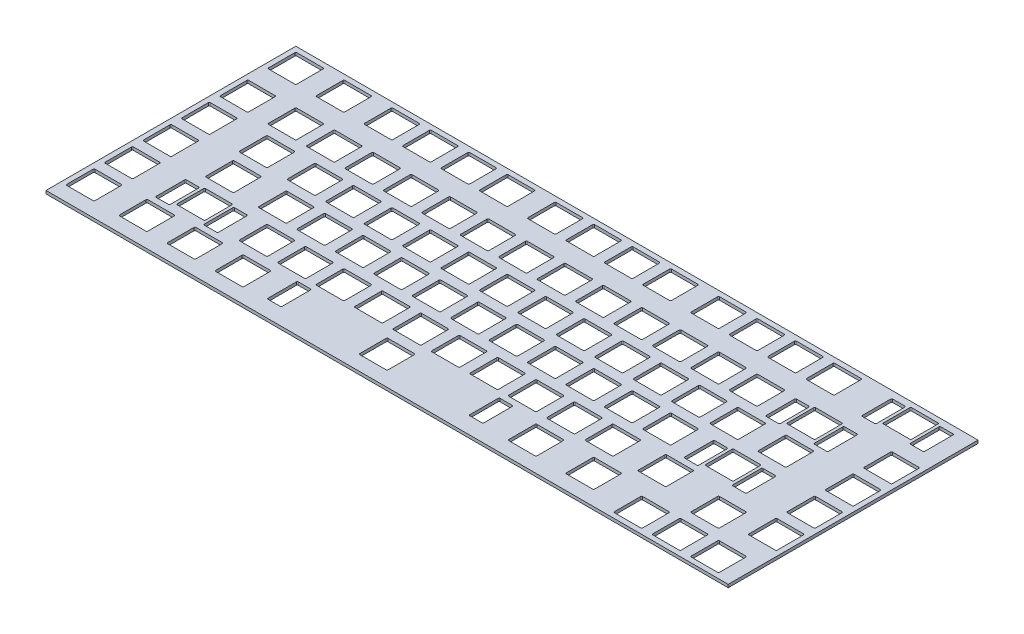
from build123d import *

# Parameters (mm, degrees)
SKETCH1_W           = 338.1375
SKETCH1_H           = 123.825
BOSS_EXTRUDE1_DEPTH = 1.5


with BuildPart() as part:
    # Sketch1 → Boss-Extrude1 (new body)
    with BuildSketch(Plane(origin=(0, 0, 0), x_dir=(1, 0, 0), z_dir=(0, 1, 0))):
        with Locations((169.06875, -61.9125)):
            Rectangle(SKETCH1_W, SKETCH1_H)
        with BuildLine():
            Line((3.025, -2.525), (16.025, -2.525))
            ThreePointArc((16.025, -2.525), (16.378553391, -2.671446609), (16.525, -3.025))
            Line((16.525, -3.025), (16.525, -16.025))
            ThreePointArc((16.525, -16.025), (16.378553391, -16.378553391), (16.025, -16.525))
            Line((16.025, -16.525), (3.025, -16.525))
            ThreePointArc((3.025, -16.525), (2.671446609, -16.378553391), (2.525, -16.025))
            Line((2.525, -16.025), (2.525, -3.025))
            ThreePointArc((2.525, -3.025), (2.671446609, -2.671446609), (3.025, -2.525))
        make_face(mode=Mode.SUBTRACT)
        with BuildLine():
            Line((26.8375, -2.525), (39.8375, -2.525))
            ThreePointArc((39.8375, -2.525), (40.191053391, -2.671446609), (40.3375, -3.025))
            Line((40.3375, -3.025), (40.3375, -16.025))
            ThreePointArc((40.3375, -16.025), (40.191053391, -16.378553391), (39.8375, -16.525))
            Line((39.8375, -16.525), (26.8375, -16.525))
            ThreePointArc((26.8375, -16.525), (26.483946609, -16.378553391), (26.3375, -16.025))
            Line((26.3375, -16.025), (26.3375, -3.025))
            ThreePointArc((26.3375, -3.025), (26.483946609, -2.671446609), (26.8375, -2.525))
        make_face(mode=Mode.SUBTRACT)
        with BuildLine():
            Line((50.65, -2.525), (63.65, -2.525))
            ThreePointArc((63.65, -2.525), (64.003553391, -2.671446609), (64.15, -3.025))
            Line((64.15, -3.025), (64.15, -16.025))
            ThreePointArc((64.15, -16.025), (64.003553391, -16.378553391), (63.65, -16.525))
            Line((63.65, -16.525), (50.65, -16.525))
            ThreePointArc((50.65, -16.525), (50.296446609, -16.378553391), (50.15, -16.025))
            Line((50.15, -16.025), (50.15, -3.025))
            ThreePointArc((50.15, -3.025), (50.296446609, -2.671446609), (50.65, -2.525))
        make_face(mode=Mode.SUBTRACT)
        with BuildLine():
            Line((69.7, -2.525), (82.7, -2.525))
            ThreePointArc((82.7, -2.525), (83.053553391, -2.671446609), (83.2, -3.025))
            Line((83.2, -3.025), (83.2, -16.025))
            ThreePointArc((83.2, -16.025), (83.053553391, -16.378553391), (82.7, -16.525))
            Line((82.7, -16.525), (69.7, -16.525))
            ThreePointArc((69.7, -16.525), (69.346446609, -16.378553391), (69.2, -16.025))
            Line((69.2, -16.025), (69.2, -3.025))
            ThreePointArc((69.2, -3.025), (69.346446609, -2.671446609), (69.7, -2.525))
        make_face(mode=Mode.SUBTRACT)
        with BuildLine():
            Line((88.75, -2.525), (101.75, -2.525))
            ThreePointArc((101.75, -2.525), (102.103553391, -2.671446609), (102.25, -3.025))
            Line((102.25, -3.025), (102.25, -16.025))
            ThreePointArc((102.25, -16.025), (102.103553391, -16.378553391), (101.75, -16.525))
            Line((101.75, -16.525), (88.75, -16.525))
            ThreePointArc((88.75, -16.525), (88.396446609, -16.378553391), (88.25, -16.025))
            Line((88.25, -16.025), (88.25, -3.025))
            ThreePointArc((88.25, -3.025), (88.396446609, -2.671446609), (88.75, -2.525))
        make_face(mode=Mode.SUBTRACT)
        with BuildLine():
            Line((107.8, -2.525), (120.8, -2.525))
            ThreePointArc((120.8, -2.525), (121.153553391, -2.671446609), (121.3, -3.025))
            Line((121.3, -3.025), (121.3, -16.025))
            ThreePointArc((121.3, -16.025), (121.153553391, -16.378553391), (120.8, -16.525))
            Line((120.8, -16.525), (107.8, -16.525))
            ThreePointArc((107.8, -16.525), (107.446446609, -16.378553391), (107.3, -16.025))
            Line((107.3, -16.025), (107.3, -3.025))
            ThreePointArc((107.3, -3.025), (107.446446609, -2.671446609), (107.8, -2.525))
        make_face(mode=Mode.SUBTRACT)
        with BuildLine():
            Line((131.6125, -2.525), (144.6125, -2.525))
            ThreePointArc((144.6125, -2.525), (144.966053391, -2.671446609), (145.1125, -3.025))
            Line((145.1125, -3.025), (145.1125, -16.025))
            ThreePointArc((145.1125, -16.025), (144.966053391, -16.378553391), (144.6125, -16.525))
            Line((144.6125, -16.525), (131.6125, -16.525))
            ThreePointArc((131.6125, -16.525), (131.258946609, -16.378553391), (131.1125, -16.025))
            Line((131.1125, -16.025), (131.1125, -3.025))
            ThreePointArc((131.1125, -3.025), (131.258946609, -2.671446609), (131.6125, -2.525))
        make_face(mode=Mode.SUBTRACT)
        with BuildLine():
            Line((150.6625, -2.525), (163.6625, -2.525))
            ThreePointArc((163.6625, -2.525), (164.016053391, -2.671446609), (164.1625, -3.025))
            Line((164.1625, -3.025), (164.1625, -16.025))
            ThreePointArc((164.1625, -16.025), (164.016053391, -16.378553391), (163.6625, -16.525))
            Line((163.6625, -16.525), (150.6625, -16.525))
            ThreePointArc((150.6625, -16.525), (150.308946609, -16.378553391), (150.1625, -16.025))
            Line((150.1625, -16.025), (150.1625, -3.025))
            ThreePointArc((150.1625, -3.025), (150.308946609, -2.671446609), (150.6625, -2.525))
        make_face(mode=Mode.SUBTRACT)
        with BuildLine():
            Line((169.7125, -2.525), (182.7125, -2.525))
            ThreePointArc((182.7125, -2.525), (183.066053391, -2.671446609), (183.2125, -3.025))
            Line((183.2125, -3.025), (183.2125, -16.025))
            ThreePointArc((183.2125, -16.025), (183.066053391, -16.378553391), (182.7125, -16.525))
            Line((182.7125, -16.525), (169.7125, -16.525))
            ThreePointArc((169.7125, -16.525), (169.358946609, -16.378553391), (169.2125, -16.025))
            Line((169.2125, -16.025), (169.2125, -3.025))
            ThreePointArc((169.2125, -3.025), (169.358946609, -2.671446609), (169.7125, -2.525))
        make_face(mode=Mode.SUBTRACT)
        with BuildLine():
            Line((188.7625, -2.525), (201.7625, -2.525))
            ThreePointArc((201.7625, -2.525), (202.116053391, -2.671446609), (202.2625, -3.025))
            Line((202.2625, -3.025), (202.2625, -16.025))
            ThreePointArc((202.2625, -16.025), (202.116053391, -16.378553391), (201.7625, -16.525))
            Line((201.7625, -16.525), (188.7625, -16.525))
            ThreePointArc((188.7625, -16.525), (188.408946609, -16.378553391), (188.2625, -16.025))
            Line((188.2625, -16.025), (188.2625, -3.025))
            ThreePointArc((188.2625, -3.025), (188.408946609, -2.671446609), (188.7625, -2.525))
        make_face(mode=Mode.SUBTRACT)
        with BuildLine():
            Line((212.575, -2.525), (225.575, -2.525))
            ThreePointArc((225.575, -2.525), (225.928553391, -2.671446609), (226.075, -3.025))
            Line((226.075, -3.025), (226.075, -16.025))
            ThreePointArc((226.075, -16.025), (225.928553391, -16.378553391), (225.575, -16.525))
            Line((225.575, -16.525), (212.575, -16.525))
            ThreePointArc((212.575, -16.525), (212.221446609, -16.378553391), (212.075, -16.025))
            Line((212.075, -16.025), (212.075, -3.025))
            ThreePointArc((212.075, -3.025), (212.221446609, -2.671446609), (212.575, -2.525))
        make_face(mode=Mode.SUBTRACT)
        with BuildLine():
            Line((231.625, -2.525), (244.625, -2.525))
            ThreePointArc((244.625, -2.525), (244.978553391, -2.671446609), (245.125, -3.025))
            Line((245.125, -3.025), (245.125, -16.025))
            ThreePointArc((245.125, -16.025), (244.978553391, -16.378553391), (244.625, -16.525))
            Line((244.625, -16.525), (231.625, -16.525))
            ThreePointArc((231.625, -16.525), (231.271446609, -16.378553391), (231.125, -16.025))
            Line((231.125, -16.025), (231.125, -3.025))
            ThreePointArc((231.125, -3.025), (231.271446609, -2.671446609), (231.625, -2.525))
        make_face(mode=Mode.SUBTRACT)
        with BuildLine():
            Line((250.675, -2.525), (263.675, -2.525))
            ThreePointArc((263.675, -2.525), (264.028553391, -2.671446609), (264.175, -3.025))
            Line((264.175, -3.025), (264.175, -16.025))
            ThreePointArc((264.175, -16.025), (264.028553391, -16.378553391), (263.675, -16.525))
            Line((263.675, -16.525), (250.675, -16.525))
            ThreePointArc((250.675, -16.525), (250.321446609, -16.378553391), (250.175, -16.025))
            Line((250.175, -16.025), (250.175, -3.025))
            ThreePointArc((250.175, -3.025), (250.321446609, -2.671446609), (250.675, -2.525))
        make_face(mode=Mode.SUBTRACT)
        with BuildLine():
            Line((269.725, -2.525), (282.725, -2.525))
            ThreePointArc((282.725, -2.525), (283.078553391, -2.671446609), (283.225, -3.025))
            Line((283.225, -3.025), (283.225, -16.025))
            ThreePointArc((283.225, -16.025), (283.078553391, -16.378553391), (282.725, -16.525))
            Line((282.725, -16.525), (269.725, -16.525))
            ThreePointArc((269.725, -16.525), (269.371446609, -16.378553391), (269.225, -16.025))
            Line((269.225, -16.025), (269.225, -3.025))
            ThreePointArc((269.225, -3.025), (269.371446609, -2.671446609), (269.725, -2.525))
        make_face(mode=Mode.SUBTRACT)
        with BuildLine():
            Line((307.825, -2.525), (320.825, -2.525))
            ThreePointArc((320.825, -2.525), (321.178553391, -2.671446609), (321.325, -3.025))
            Line((321.325, -3.025), (321.325, -16.025))
            ThreePointArc((321.325, -16.025), (321.178553391, -16.378553391), (320.825, -16.525))
            Line((320.825, -16.525), (307.825, -16.525))
            ThreePointArc((307.825, -16.525), (307.471446609, -16.378553391), (307.325, -16.025))
            Line((307.325, -16.025), (307.325, -3.025))
            ThreePointArc((307.325, -3.025), (307.471446609, -2.671446609), (307.825, -2.525))
        make_face(mode=Mode.SUBTRACT)
        with BuildLine():
            Line((299.387, -3.525), (305.387, -3.525))
            ThreePointArc((305.387, -3.525), (305.740553391, -3.671446609), (305.887, -4.025))
            Line((305.887, -4.025), (305.887, -18.025))
            ThreePointArc((305.887, -18.025), (305.740553391, -18.378553391), (305.387, -18.525))
            Line((305.387, -18.525), (299.387, -18.525))
            ThreePointArc((299.387, -18.525), (299.033446609, -18.378553391), (298.887, -18.025))
            Line((298.887, -18.025), (298.887, -4.025))
            ThreePointArc((298.887, -4.025), (299.033446609, -3.671446609), (299.387, -3.525))
        make_face(mode=Mode.SUBTRACT)
        with BuildLine():
            Line((323.263, -3.525), (329.263, -3.525))
            ThreePointArc((329.263, -3.525), (329.616553391, -3.671446609), (329.763, -4.025))
            Line((329.763, -4.025), (329.763, -18.025))
            ThreePointArc((329.763, -18.025), (329.616553391, -18.378553391), (329.263, -18.525))
            Line((329.263, -18.525), (323.263, -18.525))
            ThreePointArc((323.263, -18.525), (322.909446609, -18.378553391), (322.763, -18.025))
            Line((322.763, -18.025), (322.763, -4.025))
            ThreePointArc((322.763, -4.025), (322.909446609, -3.671446609), (323.263, -3.525))
        make_face(mode=Mode.SUBTRACT)
        with BuildLine():
            Line((3.025, -26.3375), (16.025, -26.3375))
            ThreePointArc((16.025, -26.3375), (16.378553391, -26.483946609), (16.525, -26.8375))
            Line((16.525, -26.8375), (16.525, -39.8375))
            ThreePointArc((16.525, -39.8375), (16.378553391, -40.191053391), (16.025, -40.3375))
            Line((16.025, -40.3375), (3.025, -40.3375))
            ThreePointArc((3.025, -40.3375), (2.671446609, -40.191053391), (2.525, -39.8375))
            Line((2.525, -39.8375), (2.525, -26.8375))
            ThreePointArc((2.525, -26.8375), (2.671446609, -26.483946609), (3.025, -26.3375))
        make_face(mode=Mode.SUBTRACT)
        with BuildLine():
            Line((26.8375, -26.3375), (39.8375, -26.3375))
            ThreePointArc((39.8375, -26.3375), (40.191053391, -26.483946609), (40.3375, -26.8375))
            Line((40.3375, -26.8375), (40.3375, -39.8375))
            ThreePointArc((40.3375, -39.8375), (40.191053391, -40.191053391), (39.8375, -40.3375))
            Line((39.8375, -40.3375), (26.8375, -40.3375))
            ThreePointArc((26.8375, -40.3375), (26.483946609, -40.191053391), (26.3375, -39.8375))
            Line((26.3375, -39.8375), (26.3375, -26.8375))
            ThreePointArc((26.3375, -26.8375), (26.483946609, -26.483946609), (26.8375, -26.3375))
        make_face(mode=Mode.SUBTRACT)
        with BuildLine():
            Line((45.8875, -26.3375), (58.8875, -26.3375))
            ThreePointArc((58.8875, -26.3375), (59.241053391, -26.483946609), (59.3875, -26.8375))
            Line((59.3875, -26.8375), (59.3875, -39.8375))
            ThreePointArc((59.3875, -39.8375), (59.241053391, -40.191053391), (58.8875, -40.3375))
            Line((58.8875, -40.3375), (45.8875, -40.3375))
            ThreePointArc((45.8875, -40.3375), (45.533946609, -40.191053391), (45.3875, -39.8375))
            Line((45.3875, -39.8375), (45.3875, -26.8375))
            ThreePointArc((45.3875, -26.8375), (45.533946609, -26.483946609), (45.8875, -26.3375))
        make_face(mode=Mode.SUBTRACT)
        with BuildLine():
            Line((64.9375, -26.3375), (77.9375, -26.3375))
            ThreePointArc((77.9375, -26.3375), (78.291053391, -26.483946609), (78.4375, -26.8375))
            Line((78.4375, -26.8375), (78.4375, -39.8375))
            ThreePointArc((78.4375, -39.8375), (78.291053391, -40.191053391), (77.9375, -40.3375))
            Line((77.9375, -40.3375), (64.9375, -40.3375))
            ThreePointArc((64.9375, -40.3375), (64.583946609, -40.191053391), (64.4375, -39.8375))
            Line((64.4375, -39.8375), (64.4375, -26.8375))
            ThreePointArc((64.4375, -26.8375), (64.583946609, -26.483946609), (64.9375, -26.3375))
        make_face(mode=Mode.SUBTRACT)
        with BuildLine():
            Line((83.9875, -26.3375), (96.9875, -26.3375))
            ThreePointArc((96.9875, -26.3375), (97.341053391, -26.483946609), (97.4875, -26.8375))
            Line((97.4875, -26.8375), (97.4875, -39.8375))
            ThreePointArc((97.4875, -39.8375), (97.341053391, -40.191053391), (96.9875, -40.3375))
            Line((96.9875, -40.3375), (83.9875, -40.3375))
            ThreePointArc((83.9875, -40.3375), (83.633946609, -40.191053391), (83.4875, -39.8375))
            Line((83.4875, -39.8375), (83.4875, -26.8375))
            ThreePointArc((83.4875, -26.8375), (83.633946609, -26.483946609), (83.9875, -26.3375))
        make_face(mode=Mode.SUBTRACT)
        with BuildLine():
            Line((103.0375, -26.3375), (116.0375, -26.3375))
            ThreePointArc((116.0375, -26.3375), (116.391053391, -26.483946609), (116.5375, -26.8375))
            Line((116.5375, -26.8375), (116.5375, -39.8375))
            ThreePointArc((116.5375, -39.8375), (116.391053391, -40.191053391), (116.0375, -40.3375))
            Line((116.0375, -40.3375), (103.0375, -40.3375))
            ThreePointArc((103.0375, -40.3375), (102.683946609, -40.191053391), (102.5375, -39.8375))
            Line((102.5375, -39.8375), (102.5375, -26.8375))
            ThreePointArc((102.5375, -26.8375), (102.683946609, -26.483946609), (103.0375, -26.3375))
        make_face(mode=Mode.SUBTRACT)
        with BuildLine():
            Line((122.0875, -26.3375), (135.0875, -26.3375))
            ThreePointArc((135.0875, -26.3375), (135.441053391, -26.483946609), (135.5875, -26.8375))
            Line((135.5875, -26.8375), (135.5875, -39.8375))
            ThreePointArc((135.5875, -39.8375), (135.441053391, -40.191053391), (135.0875, -40.3375))
            Line((135.0875, -40.3375), (122.0875, -40.3375))
            ThreePointArc((122.0875, -40.3375), (121.733946609, -40.191053391), (121.5875, -39.8375))
            Line((121.5875, -39.8375), (121.5875, -26.8375))
            ThreePointArc((121.5875, -26.8375), (121.733946609, -26.483946609), (122.0875, -26.3375))
        make_face(mode=Mode.SUBTRACT)
        with BuildLine():
            Line((141.1375, -26.3375), (154.1375, -26.3375))
            ThreePointArc((154.1375, -26.3375), (154.491053391, -26.483946609), (154.6375, -26.8375))
            Line((154.6375, -26.8375), (154.6375, -39.8375))
            ThreePointArc((154.6375, -39.8375), (154.491053391, -40.191053391), (154.1375, -40.3375))
            Line((154.1375, -40.3375), (141.1375, -40.3375))
            ThreePointArc((141.1375, -40.3375), (140.783946609, -40.191053391), (140.6375, -39.8375))
            Line((140.6375, -39.8375), (140.6375, -26.8375))
            ThreePointArc((140.6375, -26.8375), (140.783946609, -26.483946609), (141.1375, -26.3375))
        make_face(mode=Mode.SUBTRACT)
        with BuildLine():
            Line((160.1875, -26.3375), (173.1875, -26.3375))
            ThreePointArc((173.1875, -26.3375), (173.541053391, -26.483946609), (173.6875, -26.8375))
            Line((173.6875, -26.8375), (173.6875, -39.8375))
            ThreePointArc((173.6875, -39.8375), (173.541053391, -40.191053391), (173.1875, -40.3375))
            Line((173.1875, -40.3375), (160.1875, -40.3375))
            ThreePointArc((160.1875, -40.3375), (159.833946609, -40.191053391), (159.6875, -39.8375))
            Line((159.6875, -39.8375), (159.6875, -26.8375))
            ThreePointArc((159.6875, -26.8375), (159.833946609, -26.483946609), (160.1875, -26.3375))
        make_face(mode=Mode.SUBTRACT)
        with BuildLine():
            Line((179.2375, -26.3375), (192.2375, -26.3375))
            ThreePointArc((192.2375, -26.3375), (192.591053391, -26.483946609), (192.7375, -26.8375))
            Line((192.7375, -26.8375), (192.7375, -39.8375))
            ThreePointArc((192.7375, -39.8375), (192.591053391, -40.191053391), (192.2375, -40.3375))
            Line((192.2375, -40.3375), (179.2375, -40.3375))
            ThreePointArc((179.2375, -40.3375), (178.883946609, -40.191053391), (178.7375, -39.8375))
            Line((178.7375, -39.8375), (178.7375, -26.8375))
            ThreePointArc((178.7375, -26.8375), (178.883946609, -26.483946609), (179.2375, -26.3375))
        make_face(mode=Mode.SUBTRACT)
        with BuildLine():
            Line((198.2875, -26.3375), (211.2875, -26.3375))
            ThreePointArc((211.2875, -26.3375), (211.641053391, -26.483946609), (211.7875, -26.8375))
            Line((211.7875, -26.8375), (211.7875, -39.8375))
            ThreePointArc((211.7875, -39.8375), (211.641053391, -40.191053391), (211.2875, -40.3375))
            Line((211.2875, -40.3375), (198.2875, -40.3375))
            ThreePointArc((198.2875, -40.3375), (197.933946609, -40.191053391), (197.7875, -39.8375))
            Line((197.7875, -39.8375), (197.7875, -26.8375))
            ThreePointArc((197.7875, -26.8375), (197.933946609, -26.483946609), (198.2875, -26.3375))
        make_face(mode=Mode.SUBTRACT)
        with BuildLine():
            Line((217.3375, -26.3375), (230.3375, -26.3375))
            ThreePointArc((230.3375, -26.3375), (230.691053391, -26.483946609), (230.8375, -26.8375))
            Line((230.8375, -26.8375), (230.8375, -39.8375))
            ThreePointArc((230.8375, -39.8375), (230.691053391, -40.191053391), (230.3375, -40.3375))
            Line((230.3375, -40.3375), (217.3375, -40.3375))
            ThreePointArc((217.3375, -40.3375), (216.983946609, -40.191053391), (216.8375, -39.8375))
            Line((216.8375, -39.8375), (216.8375, -26.8375))
            ThreePointArc((216.8375, -26.8375), (216.983946609, -26.483946609), (217.3375, -26.3375))
        make_face(mode=Mode.SUBTRACT)
        with BuildLine():
            Line((236.3875, -26.3375), (249.3875, -26.3375))
            ThreePointArc((249.3875, -26.3375), (249.741053391, -26.483946609), (249.8875, -26.8375))
            Line((249.8875, -26.8375), (249.8875, -39.8375))
            ThreePointArc((249.8875, -39.8375), (249.741053391, -40.191053391), (249.3875, -40.3375))
            Line((249.3875, -40.3375), (236.3875, -40.3375))
            ThreePointArc((236.3875, -40.3375), (236.033946609, -40.191053391), (235.8875, -39.8375))
            Line((235.8875, -39.8375), (235.8875, -26.8375))
            ThreePointArc((235.8875, -26.8375), (236.033946609, -26.483946609), (236.3875, -26.3375))
        make_face(mode=Mode.SUBTRACT)
        with BuildLine():
            Line((255.4375, -26.3375), (268.4375, -26.3375))
            ThreePointArc((268.4375, -26.3375), (268.791053391, -26.483946609), (268.9375, -26.8375))
            Line((268.9375, -26.8375), (268.9375, -39.8375))
            ThreePointArc((268.9375, -39.8375), (268.791053391, -40.191053391), (268.4375, -40.3375))
            Line((268.4375, -40.3375), (255.4375, -40.3375))
            ThreePointArc((255.4375, -40.3375), (255.083946609, -40.191053391), (254.9375, -39.8375))
            Line((254.9375, -39.8375), (254.9375, -26.8375))
            ThreePointArc((254.9375, -26.8375), (255.083946609, -26.483946609), (255.4375, -26.3375))
        make_face(mode=Mode.SUBTRACT)
        with BuildLine():
            Line((284.0125, -26.3375), (297.0125, -26.3375))
            ThreePointArc((297.0125, -26.3375), (297.366053391, -26.483946609), (297.5125, -26.8375))
            Line((297.5125, -26.8375), (297.5125, -39.8375))
            ThreePointArc((297.5125, -39.8375), (297.366053391, -40.191053391), (297.0125, -40.3375))
            Line((297.0125, -40.3375), (284.0125, -40.3375))
            ThreePointArc((284.0125, -40.3375), (283.658946609, -40.191053391), (283.5125, -39.8375))
            Line((283.5125, -39.8375), (283.5125, -26.8375))
            ThreePointArc((283.5125, -26.8375), (283.658946609, -26.483946609), (284.0125, -26.3375))
        make_face(mode=Mode.SUBTRACT)
        with BuildLine():
            Line((275.5745, -27.3375), (281.5745, -27.3375))
            ThreePointArc((281.5745, -27.3375), (281.928053391, -27.483946609), (282.0745, -27.8375))
            Line((282.0745, -27.8375), (282.0745, -41.8375))
            ThreePointArc((282.0745, -41.8375), (281.928053391, -42.191053391), (281.5745, -42.3375))
            Line((281.5745, -42.3375), (275.5745, -42.3375))
            ThreePointArc((275.5745, -42.3375), (275.220946609, -42.191053391), (275.0745, -41.8375))
            Line((275.0745, -41.8375), (275.0745, -27.8375))
            ThreePointArc((275.0745, -27.8375), (275.220946609, -27.483946609), (275.5745, -27.3375))
        make_face(mode=Mode.SUBTRACT)
        with BuildLine():
            Line((299.4505, -27.3375), (305.4505, -27.3375))
            ThreePointArc((305.4505, -27.3375), (305.804053391, -27.483946609), (305.9505, -27.8375))
            Line((305.9505, -27.8375), (305.9505, -41.8375))
            ThreePointArc((305.9505, -41.8375), (305.804053391, -42.191053391), (305.4505, -42.3375))
            Line((305.4505, -42.3375), (299.4505, -42.3375))
            ThreePointArc((299.4505, -42.3375), (299.096946609, -42.191053391), (298.9505, -41.8375))
            Line((298.9505, -41.8375), (298.9505, -27.8375))
            ThreePointArc((298.9505, -27.8375), (299.096946609, -27.483946609), (299.4505, -27.3375))
        make_face(mode=Mode.SUBTRACT)
        with BuildLine():
            Line((322.1125, -26.3375), (335.1125, -26.3375))
            ThreePointArc((335.1125, -26.3375), (335.466053391, -26.483946609), (335.6125, -26.8375))
            Line((335.6125, -26.8375), (335.6125, -39.8375))
            ThreePointArc((335.6125, -39.8375), (335.466053391, -40.191053391), (335.1125, -40.3375))
            Line((335.1125, -40.3375), (322.1125, -40.3375))
            ThreePointArc((322.1125, -40.3375), (321.758946609, -40.191053391), (321.6125, -39.8375))
            Line((321.6125, -39.8375), (321.6125, -26.8375))
            ThreePointArc((321.6125, -26.8375), (321.758946609, -26.483946609), (322.1125, -26.3375))
        make_face(mode=Mode.SUBTRACT)
        with BuildLine():
            Line((3.025, -45.3875), (16.025, -45.3875))
            ThreePointArc((16.025, -45.3875), (16.378553391, -45.533946609), (16.525, -45.8875))
            Line((16.525, -45.8875), (16.525, -58.8875))
            ThreePointArc((16.525, -58.8875), (16.378553391, -59.241053391), (16.025, -59.3875))
            Line((16.025, -59.3875), (3.025, -59.3875))
            ThreePointArc((3.025, -59.3875), (2.671446609, -59.241053391), (2.525, -58.8875))
            Line((2.525, -58.8875), (2.525, -45.8875))
            ThreePointArc((2.525, -45.8875), (2.671446609, -45.533946609), (3.025, -45.3875))
        make_face(mode=Mode.SUBTRACT)
        with BuildLine():
            Line((31.6, -45.3875), (44.6, -45.3875))
            ThreePointArc((44.6, -45.3875), (44.953553391, -45.533946609), (45.1, -45.8875))
            Line((45.1, -45.8875), (45.1, -58.8875))
            ThreePointArc((45.1, -58.8875), (44.953553391, -59.241053391), (44.6, -59.3875))
            Line((44.6, -59.3875), (31.6, -59.3875))
            ThreePointArc((31.6, -59.3875), (31.246446609, -59.241053391), (31.1, -58.8875))
            Line((31.1, -58.8875), (31.1, -45.8875))
            ThreePointArc((31.1, -45.8875), (31.246446609, -45.533946609), (31.6, -45.3875))
        make_face(mode=Mode.SUBTRACT)
        with BuildLine():
            Line((55.4125, -45.3875), (68.4125, -45.3875))
            ThreePointArc((68.4125, -45.3875), (68.766053391, -45.533946609), (68.9125, -45.8875))
            Line((68.9125, -45.8875), (68.9125, -58.8875))
            ThreePointArc((68.9125, -58.8875), (68.766053391, -59.241053391), (68.4125, -59.3875))
            Line((68.4125, -59.3875), (55.4125, -59.3875))
            ThreePointArc((55.4125, -59.3875), (55.058946609, -59.241053391), (54.9125, -58.8875))
            Line((54.9125, -58.8875), (54.9125, -45.8875))
            ThreePointArc((54.9125, -45.8875), (55.058946609, -45.533946609), (55.4125, -45.3875))
        make_face(mode=Mode.SUBTRACT)
        with BuildLine():
            Line((74.4625, -45.3875), (87.4625, -45.3875))
            ThreePointArc((87.4625, -45.3875), (87.816053391, -45.533946609), (87.9625, -45.8875))
            Line((87.9625, -45.8875), (87.9625, -58.8875))
            ThreePointArc((87.9625, -58.8875), (87.816053391, -59.241053391), (87.4625, -59.3875))
            Line((87.4625, -59.3875), (74.4625, -59.3875))
            ThreePointArc((74.4625, -59.3875), (74.108946609, -59.241053391), (73.9625, -58.8875))
            Line((73.9625, -58.8875), (73.9625, -45.8875))
            ThreePointArc((73.9625, -45.8875), (74.108946609, -45.533946609), (74.4625, -45.3875))
        make_face(mode=Mode.SUBTRACT)
        with BuildLine():
            Line((93.5125, -45.3875), (106.5125, -45.3875))
            ThreePointArc((106.5125, -45.3875), (106.866053391, -45.533946609), (107.0125, -45.8875))
            Line((107.0125, -45.8875), (107.0125, -58.8875))
            ThreePointArc((107.0125, -58.8875), (106.866053391, -59.241053391), (106.5125, -59.3875))
            Line((106.5125, -59.3875), (93.5125, -59.3875))
            ThreePointArc((93.5125, -59.3875), (93.158946609, -59.241053391), (93.0125, -58.8875))
            Line((93.0125, -58.8875), (93.0125, -45.8875))
            ThreePointArc((93.0125, -45.8875), (93.158946609, -45.533946609), (93.5125, -45.3875))
        make_face(mode=Mode.SUBTRACT)
        with BuildLine():
            Line((112.5625, -45.3875), (125.5625, -45.3875))
            ThreePointArc((125.5625, -45.3875), (125.916053391, -45.533946609), (126.0625, -45.8875))
            Line((126.0625, -45.8875), (126.0625, -58.8875))
            ThreePointArc((126.0625, -58.8875), (125.916053391, -59.241053391), (125.5625, -59.3875))
            Line((125.5625, -59.3875), (112.5625, -59.3875))
            ThreePointArc((112.5625, -59.3875), (112.208946609, -59.241053391), (112.0625, -58.8875))
            Line((112.0625, -58.8875), (112.0625, -45.8875))
            ThreePointArc((112.0625, -45.8875), (112.208946609, -45.533946609), (112.5625, -45.3875))
        make_face(mode=Mode.SUBTRACT)
        with BuildLine():
            Line((131.6125, -45.3875), (144.6125, -45.3875))
            ThreePointArc((144.6125, -45.3875), (144.966053391, -45.533946609), (145.1125, -45.8875))
            Line((145.1125, -45.8875), (145.1125, -58.8875))
            ThreePointArc((145.1125, -58.8875), (144.966053391, -59.241053391), (144.6125, -59.3875))
            Line((144.6125, -59.3875), (131.6125, -59.3875))
            ThreePointArc((131.6125, -59.3875), (131.258946609, -59.241053391), (131.1125, -58.8875))
            Line((131.1125, -58.8875), (131.1125, -45.8875))
            ThreePointArc((131.1125, -45.8875), (131.258946609, -45.533946609), (131.6125, -45.3875))
        make_face(mode=Mode.SUBTRACT)
        with BuildLine():
            Line((150.6625, -45.3875), (163.6625, -45.3875))
            ThreePointArc((163.6625, -45.3875), (164.016053391, -45.533946609), (164.1625, -45.8875))
            Line((164.1625, -45.8875), (164.1625, -58.8875))
            ThreePointArc((164.1625, -58.8875), (164.016053391, -59.241053391), (163.6625, -59.3875))
            Line((163.6625, -59.3875), (150.6625, -59.3875))
            ThreePointArc((150.6625, -59.3875), (150.308946609, -59.241053391), (150.1625, -58.8875))
            Line((150.1625, -58.8875), (150.1625, -45.8875))
            ThreePointArc((150.1625, -45.8875), (150.308946609, -45.533946609), (150.6625, -45.3875))
        make_face(mode=Mode.SUBTRACT)
        with BuildLine():
            Line((169.7125, -45.3875), (182.7125, -45.3875))
            ThreePointArc((182.7125, -45.3875), (183.066053391, -45.533946609), (183.2125, -45.8875))
            Line((183.2125, -45.8875), (183.2125, -58.8875))
            ThreePointArc((183.2125, -58.8875), (183.066053391, -59.241053391), (182.7125, -59.3875))
            Line((182.7125, -59.3875), (169.7125, -59.3875))
            ThreePointArc((169.7125, -59.3875), (169.358946609, -59.241053391), (169.2125, -58.8875))
            Line((169.2125, -58.8875), (169.2125, -45.8875))
            ThreePointArc((169.2125, -45.8875), (169.358946609, -45.533946609), (169.7125, -45.3875))
        make_face(mode=Mode.SUBTRACT)
        with BuildLine():
            Line((188.7625, -45.3875), (201.7625, -45.3875))
            ThreePointArc((201.7625, -45.3875), (202.116053391, -45.533946609), (202.2625, -45.8875))
            Line((202.2625, -45.8875), (202.2625, -58.8875))
            ThreePointArc((202.2625, -58.8875), (202.116053391, -59.241053391), (201.7625, -59.3875))
            Line((201.7625, -59.3875), (188.7625, -59.3875))
            ThreePointArc((188.7625, -59.3875), (188.408946609, -59.241053391), (188.2625, -58.8875))
            Line((188.2625, -58.8875), (188.2625, -45.8875))
            ThreePointArc((188.2625, -45.8875), (188.408946609, -45.533946609), (188.7625, -45.3875))
        make_face(mode=Mode.SUBTRACT)
        with BuildLine():
            Line((207.8125, -45.3875), (220.8125, -45.3875))
            ThreePointArc((220.8125, -45.3875), (221.166053391, -45.533946609), (221.3125, -45.8875))
            Line((221.3125, -45.8875), (221.3125, -58.8875))
            ThreePointArc((221.3125, -58.8875), (221.166053391, -59.241053391), (220.8125, -59.3875))
            Line((220.8125, -59.3875), (207.8125, -59.3875))
            ThreePointArc((207.8125, -59.3875), (207.458946609, -59.241053391), (207.3125, -58.8875))
            Line((207.3125, -58.8875), (207.3125, -45.8875))
            ThreePointArc((207.3125, -45.8875), (207.458946609, -45.533946609), (207.8125, -45.3875))
        make_face(mode=Mode.SUBTRACT)
        with BuildLine():
            Line((226.8625, -45.3875), (239.8625, -45.3875))
            ThreePointArc((239.8625, -45.3875), (240.216053391, -45.533946609), (240.3625, -45.8875))
            Line((240.3625, -45.8875), (240.3625, -58.8875))
            ThreePointArc((240.3625, -58.8875), (240.216053391, -59.241053391), (239.8625, -59.3875))
            Line((239.8625, -59.3875), (226.8625, -59.3875))
            ThreePointArc((226.8625, -59.3875), (226.508946609, -59.241053391), (226.3625, -58.8875))
            Line((226.3625, -58.8875), (226.3625, -45.8875))
            ThreePointArc((226.3625, -45.8875), (226.508946609, -45.533946609), (226.8625, -45.3875))
        make_face(mode=Mode.SUBTRACT)
        with BuildLine():
            Line((245.9125, -45.3875), (258.9125, -45.3875))
            ThreePointArc((258.9125, -45.3875), (259.266053391, -45.533946609), (259.4125, -45.8875))
            Line((259.4125, -45.8875), (259.4125, -58.8875))
            ThreePointArc((259.4125, -58.8875), (259.266053391, -59.241053391), (258.9125, -59.3875))
            Line((258.9125, -59.3875), (245.9125, -59.3875))
            ThreePointArc((245.9125, -59.3875), (245.558946609, -59.241053391), (245.4125, -58.8875))
            Line((245.4125, -58.8875), (245.4125, -45.8875))
            ThreePointArc((245.4125, -45.8875), (245.558946609, -45.533946609), (245.9125, -45.3875))
        make_face(mode=Mode.SUBTRACT)
        with BuildLine():
            Line((264.9625, -45.3875), (277.9625, -45.3875))
            ThreePointArc((277.9625, -45.3875), (278.316053391, -45.533946609), (278.4625, -45.8875))
            Line((278.4625, -45.8875), (278.4625, -58.8875))
            ThreePointArc((278.4625, -58.8875), (278.316053391, -59.241053391), (277.9625, -59.3875))
            Line((277.9625, -59.3875), (264.9625, -59.3875))
            ThreePointArc((264.9625, -59.3875), (264.608946609, -59.241053391), (264.4625, -58.8875))
            Line((264.4625, -58.8875), (264.4625, -45.8875))
            ThreePointArc((264.4625, -45.8875), (264.608946609, -45.533946609), (264.9625, -45.3875))
        make_face(mode=Mode.SUBTRACT)
        with BuildLine():
            Line((288.775, -45.3875), (301.775, -45.3875))
            ThreePointArc((301.775, -45.3875), (302.128553391, -45.533946609), (302.275, -45.8875))
            Line((302.275, -45.8875), (302.275, -58.8875))
            ThreePointArc((302.275, -58.8875), (302.128553391, -59.241053391), (301.775, -59.3875))
            Line((301.775, -59.3875), (288.775, -59.3875))
            ThreePointArc((288.775, -59.3875), (288.421446609, -59.241053391), (288.275, -58.8875))
            Line((288.275, -58.8875), (288.275, -45.8875))
            ThreePointArc((288.275, -45.8875), (288.421446609, -45.533946609), (288.775, -45.3875))
        make_face(mode=Mode.SUBTRACT)
        with BuildLine():
            Line((322.1125, -45.3875), (335.1125, -45.3875))
            ThreePointArc((335.1125, -45.3875), (335.466053391, -45.533946609), (335.6125, -45.8875))
            Line((335.6125, -45.8875), (335.6125, -58.8875))
            ThreePointArc((335.6125, -58.8875), (335.466053391, -59.241053391), (335.1125, -59.3875))
            Line((335.1125, -59.3875), (322.1125, -59.3875))
            ThreePointArc((322.1125, -59.3875), (321.758946609, -59.241053391), (321.6125, -58.8875))
            Line((321.6125, -58.8875), (321.6125, -45.8875))
            ThreePointArc((321.6125, -45.8875), (321.758946609, -45.533946609), (322.1125, -45.3875))
        make_face(mode=Mode.SUBTRACT)
        with BuildLine():
            Line((3.025, -64.4375), (16.025, -64.4375))
            ThreePointArc((16.025, -64.4375), (16.378553391, -64.583946609), (16.525, -64.9375))
            Line((16.525, -64.9375), (16.525, -77.9375))
            ThreePointArc((16.525, -77.9375), (16.378553391, -78.291053391), (16.025, -78.4375))
            Line((16.025, -78.4375), (3.025, -78.4375))
            ThreePointArc((3.025, -78.4375), (2.671446609, -78.291053391), (2.525, -77.9375))
            Line((2.525, -77.9375), (2.525, -64.9375))
            ThreePointArc((2.525, -64.9375), (2.671446609, -64.583946609), (3.025, -64.4375))
        make_face(mode=Mode.SUBTRACT)
        with BuildLine():
            Line((33.98125, -64.4375), (46.98125, -64.4375))
            ThreePointArc((46.98125, -64.4375), (47.334803391, -64.583946609), (47.48125, -64.9375))
            Line((47.48125, -64.9375), (47.48125, -77.9375))
            ThreePointArc((47.48125, -77.9375), (47.334803391, -78.291053391), (46.98125, -78.4375))
            Line((46.98125, -78.4375), (33.98125, -78.4375))
            ThreePointArc((33.98125, -78.4375), (33.627696609, -78.291053391), (33.48125, -77.9375))
            Line((33.48125, -77.9375), (33.48125, -64.9375))
            ThreePointArc((33.48125, -64.9375), (33.627696609, -64.583946609), (33.98125, -64.4375))
        make_face(mode=Mode.SUBTRACT)
        with BuildLine():
            Line((60.175, -64.4375), (73.175, -64.4375))
            ThreePointArc((73.175, -64.4375), (73.528553391, -64.583946609), (73.675, -64.9375))
            Line((73.675, -64.9375), (73.675, -77.9375))
            ThreePointArc((73.675, -77.9375), (73.528553391, -78.291053391), (73.175, -78.4375))
            Line((73.175, -78.4375), (60.175, -78.4375))
            ThreePointArc((60.175, -78.4375), (59.821446609, -78.291053391), (59.675, -77.9375))
            Line((59.675, -77.9375), (59.675, -64.9375))
            ThreePointArc((59.675, -64.9375), (59.821446609, -64.583946609), (60.175, -64.4375))
        make_face(mode=Mode.SUBTRACT)
        with BuildLine():
            Line((79.225, -64.4375), (92.225, -64.4375))
            ThreePointArc((92.225, -64.4375), (92.578553391, -64.583946609), (92.725, -64.9375))
            Line((92.725, -64.9375), (92.725, -77.9375))
            ThreePointArc((92.725, -77.9375), (92.578553391, -78.291053391), (92.225, -78.4375))
            Line((92.225, -78.4375), (79.225, -78.4375))
            ThreePointArc((79.225, -78.4375), (78.871446609, -78.291053391), (78.725, -77.9375))
            Line((78.725, -77.9375), (78.725, -64.9375))
            ThreePointArc((78.725, -64.9375), (78.871446609, -64.583946609), (79.225, -64.4375))
        make_face(mode=Mode.SUBTRACT)
        with BuildLine():
            Line((98.275, -64.4375), (111.275, -64.4375))
            ThreePointArc((111.275, -64.4375), (111.628553391, -64.583946609), (111.775, -64.9375))
            Line((111.775, -64.9375), (111.775, -77.9375))
            ThreePointArc((111.775, -77.9375), (111.628553391, -78.291053391), (111.275, -78.4375))
            Line((111.275, -78.4375), (98.275, -78.4375))
            ThreePointArc((98.275, -78.4375), (97.921446609, -78.291053391), (97.775, -77.9375))
            Line((97.775, -77.9375), (97.775, -64.9375))
            ThreePointArc((97.775, -64.9375), (97.921446609, -64.583946609), (98.275, -64.4375))
        make_face(mode=Mode.SUBTRACT)
        with BuildLine():
            Line((117.325, -64.4375), (130.325, -64.4375))
            ThreePointArc((130.325, -64.4375), (130.678553391, -64.583946609), (130.825, -64.9375))
            Line((130.825, -64.9375), (130.825, -77.9375))
            ThreePointArc((130.825, -77.9375), (130.678553391, -78.291053391), (130.325, -78.4375))
            Line((130.325, -78.4375), (117.325, -78.4375))
            ThreePointArc((117.325, -78.4375), (116.971446609, -78.291053391), (116.825, -77.9375))
            Line((116.825, -77.9375), (116.825, -64.9375))
            ThreePointArc((116.825, -64.9375), (116.971446609, -64.583946609), (117.325, -64.4375))
        make_face(mode=Mode.SUBTRACT)
        with BuildLine():
            Line((136.375, -64.4375), (149.375, -64.4375))
            ThreePointArc((149.375, -64.4375), (149.728553391, -64.583946609), (149.875, -64.9375))
            Line((149.875, -64.9375), (149.875, -77.9375))
            ThreePointArc((149.875, -77.9375), (149.728553391, -78.291053391), (149.375, -78.4375))
            Line((149.375, -78.4375), (136.375, -78.4375))
            ThreePointArc((136.375, -78.4375), (136.021446609, -78.291053391), (135.875, -77.9375))
            Line((135.875, -77.9375), (135.875, -64.9375))
            ThreePointArc((135.875, -64.9375), (136.021446609, -64.583946609), (136.375, -64.4375))
        make_face(mode=Mode.SUBTRACT)
        with BuildLine():
            Line((155.425, -64.4375), (168.425, -64.4375))
            ThreePointArc((168.425, -64.4375), (168.778553391, -64.583946609), (168.925, -64.9375))
            Line((168.925, -64.9375), (168.925, -77.9375))
            ThreePointArc((168.925, -77.9375), (168.778553391, -78.291053391), (168.425, -78.4375))
            Line((168.425, -78.4375), (155.425, -78.4375))
            ThreePointArc((155.425, -78.4375), (155.071446609, -78.291053391), (154.925, -77.9375))
            Line((154.925, -77.9375), (154.925, -64.9375))
            ThreePointArc((154.925, -64.9375), (155.071446609, -64.583946609), (155.425, -64.4375))
        make_face(mode=Mode.SUBTRACT)
        with BuildLine():
            Line((174.475, -64.4375), (187.475, -64.4375))
            ThreePointArc((187.475, -64.4375), (187.828553391, -64.583946609), (187.975, -64.9375))
            Line((187.975, -64.9375), (187.975, -77.9375))
            ThreePointArc((187.975, -77.9375), (187.828553391, -78.291053391), (187.475, -78.4375))
            Line((187.475, -78.4375), (174.475, -78.4375))
            ThreePointArc((174.475, -78.4375), (174.121446609, -78.291053391), (173.975, -77.9375))
            Line((173.975, -77.9375), (173.975, -64.9375))
            ThreePointArc((173.975, -64.9375), (174.121446609, -64.583946609), (174.475, -64.4375))
        make_face(mode=Mode.SUBTRACT)
        with BuildLine():
            Line((193.525, -64.4375), (206.525, -64.4375))
            ThreePointArc((206.525, -64.4375), (206.878553391, -64.583946609), (207.025, -64.9375))
            Line((207.025, -64.9375), (207.025, -77.9375))
            ThreePointArc((207.025, -77.9375), (206.878553391, -78.291053391), (206.525, -78.4375))
            Line((206.525, -78.4375), (193.525, -78.4375))
            ThreePointArc((193.525, -78.4375), (193.171446609, -78.291053391), (193.025, -77.9375))
            Line((193.025, -77.9375), (193.025, -64.9375))
            ThreePointArc((193.025, -64.9375), (193.171446609, -64.583946609), (193.525, -64.4375))
        make_face(mode=Mode.SUBTRACT)
        with BuildLine():
            Line((212.575, -64.4375), (225.575, -64.4375))
            ThreePointArc((225.575, -64.4375), (225.928553391, -64.583946609), (226.075, -64.9375))
            Line((226.075, -64.9375), (226.075, -77.9375))
            ThreePointArc((226.075, -77.9375), (225.928553391, -78.291053391), (225.575, -78.4375))
            Line((225.575, -78.4375), (212.575, -78.4375))
            ThreePointArc((212.575, -78.4375), (212.221446609, -78.291053391), (212.075, -77.9375))
            Line((212.075, -77.9375), (212.075, -64.9375))
            ThreePointArc((212.075, -64.9375), (212.221446609, -64.583946609), (212.575, -64.4375))
        make_face(mode=Mode.SUBTRACT)
        with BuildLine():
            Line((231.625, -64.4375), (244.625, -64.4375))
            ThreePointArc((244.625, -64.4375), (244.978553391, -64.583946609), (245.125, -64.9375))
            Line((245.125, -64.9375), (245.125, -77.9375))
            ThreePointArc((245.125, -77.9375), (244.978553391, -78.291053391), (244.625, -78.4375))
            Line((244.625, -78.4375), (231.625, -78.4375))
            ThreePointArc((231.625, -78.4375), (231.271446609, -78.291053391), (231.125, -77.9375))
            Line((231.125, -77.9375), (231.125, -64.9375))
            ThreePointArc((231.125, -64.9375), (231.271446609, -64.583946609), (231.625, -64.4375))
        make_face(mode=Mode.SUBTRACT)
        with BuildLine():
            Line((250.675, -64.4375), (263.675, -64.4375))
            ThreePointArc((263.675, -64.4375), (264.028553391, -64.583946609), (264.175, -64.9375))
            Line((264.175, -64.9375), (264.175, -77.9375))
            ThreePointArc((264.175, -77.9375), (264.028553391, -78.291053391), (263.675, -78.4375))
            Line((263.675, -78.4375), (250.675, -78.4375))
            ThreePointArc((250.675, -78.4375), (250.321446609, -78.291053391), (250.175, -77.9375))
            Line((250.175, -77.9375), (250.175, -64.9375))
            ThreePointArc((250.175, -64.9375), (250.321446609, -64.583946609), (250.675, -64.4375))
        make_face(mode=Mode.SUBTRACT)
        with BuildLine():
            Line((281.63125, -64.4375), (294.63125, -64.4375))
            ThreePointArc((294.63125, -64.4375), (294.984803391, -64.583946609), (295.13125, -64.9375))
            Line((295.13125, -64.9375), (295.13125, -77.9375))
            ThreePointArc((295.13125, -77.9375), (294.984803391, -78.291053391), (294.63125, -78.4375))
            Line((294.63125, -78.4375), (281.63125, -78.4375))
            ThreePointArc((281.63125, -78.4375), (281.277696609, -78.291053391), (281.13125, -77.9375))
            Line((281.13125, -77.9375), (281.13125, -64.9375))
            ThreePointArc((281.13125, -64.9375), (281.277696609, -64.583946609), (281.63125, -64.4375))
        make_face(mode=Mode.SUBTRACT)
        with BuildLine():
            Line((273.19325, -65.4375), (279.19325, -65.4375))
            ThreePointArc((279.19325, -65.4375), (279.546803391, -65.583946609), (279.69325, -65.9375))
            Line((279.69325, -65.9375), (279.69325, -79.9375))
            ThreePointArc((279.69325, -79.9375), (279.546803391, -80.291053391), (279.19325, -80.4375))
            Line((279.19325, -80.4375), (273.19325, -80.4375))
            ThreePointArc((273.19325, -80.4375), (272.839696609, -80.291053391), (272.69325, -79.9375))
            Line((272.69325, -79.9375), (272.69325, -65.9375))
            ThreePointArc((272.69325, -65.9375), (272.839696609, -65.583946609), (273.19325, -65.4375))
        make_face(mode=Mode.SUBTRACT)
        with BuildLine():
            Line((297.06925, -65.4375), (303.06925, -65.4375))
            ThreePointArc((303.06925, -65.4375), (303.422803391, -65.583946609), (303.56925, -65.9375))
            Line((303.56925, -65.9375), (303.56925, -79.9375))
            ThreePointArc((303.56925, -79.9375), (303.422803391, -80.291053391), (303.06925, -80.4375))
            Line((303.06925, -80.4375), (297.06925, -80.4375))
            ThreePointArc((297.06925, -80.4375), (296.715696609, -80.291053391), (296.56925, -79.9375))
            Line((296.56925, -79.9375), (296.56925, -65.9375))
            ThreePointArc((296.56925, -65.9375), (296.715696609, -65.583946609), (297.06925, -65.4375))
        make_face(mode=Mode.SUBTRACT)
        with BuildLine():
            Line((322.1125, -64.4375), (335.1125, -64.4375))
            ThreePointArc((335.1125, -64.4375), (335.466053391, -64.583946609), (335.6125, -64.9375))
            Line((335.6125, -64.9375), (335.6125, -77.9375))
            ThreePointArc((335.6125, -77.9375), (335.466053391, -78.291053391), (335.1125, -78.4375))
            Line((335.1125, -78.4375), (322.1125, -78.4375))
            ThreePointArc((322.1125, -78.4375), (321.758946609, -78.291053391), (321.6125, -77.9375))
            Line((321.6125, -77.9375), (321.6125, -64.9375))
            ThreePointArc((321.6125, -64.9375), (321.758946609, -64.583946609), (322.1125, -64.4375))
        make_face(mode=Mode.SUBTRACT)
        with BuildLine():
            Line((3.025, -83.4875), (16.025, -83.4875))
            ThreePointArc((16.025, -83.4875), (16.378553391, -83.633946609), (16.525, -83.9875))
            Line((16.525, -83.9875), (16.525, -96.9875))
            ThreePointArc((16.525, -96.9875), (16.378553391, -97.341053391), (16.025, -97.4875))
            Line((16.025, -97.4875), (3.025, -97.4875))
            ThreePointArc((3.025, -97.4875), (2.671446609, -97.341053391), (2.525, -96.9875))
            Line((2.525, -96.9875), (2.525, -83.9875))
            ThreePointArc((2.525, -83.9875), (2.671446609, -83.633946609), (3.025, -83.4875))
        make_face(mode=Mode.SUBTRACT)
        with BuildLine():
            Line((38.74375, -83.4875), (51.74375, -83.4875))
            ThreePointArc((51.74375, -83.4875), (52.097303391, -83.633946609), (52.24375, -83.9875))
            Line((52.24375, -83.9875), (52.24375, -96.9875))
            ThreePointArc((52.24375, -96.9875), (52.097303391, -97.341053391), (51.74375, -97.4875))
            Line((51.74375, -97.4875), (38.74375, -97.4875))
            ThreePointArc((38.74375, -97.4875), (38.390196609, -97.341053391), (38.24375, -96.9875))
            Line((38.24375, -96.9875), (38.24375, -83.9875))
            ThreePointArc((38.24375, -83.9875), (38.390196609, -83.633946609), (38.74375, -83.4875))
        make_face(mode=Mode.SUBTRACT)
        with BuildLine():
            Line((30.30575, -84.4875), (36.30575, -84.4875))
            ThreePointArc((36.30575, -84.4875), (36.659303391, -84.633946609), (36.80575, -84.9875))
            Line((36.80575, -84.9875), (36.80575, -98.9875))
            ThreePointArc((36.80575, -98.9875), (36.659303391, -99.341053391), (36.30575, -99.4875))
            Line((36.30575, -99.4875), (30.30575, -99.4875))
            ThreePointArc((30.30575, -99.4875), (29.952196609, -99.341053391), (29.80575, -98.9875))
            Line((29.80575, -98.9875), (29.80575, -84.9875))
            ThreePointArc((29.80575, -84.9875), (29.952196609, -84.633946609), (30.30575, -84.4875))
        make_face(mode=Mode.SUBTRACT)
        with BuildLine():
            Line((54.18175, -84.4875), (60.18175, -84.4875))
            ThreePointArc((60.18175, -84.4875), (60.535303391, -84.633946609), (60.68175, -84.9875))
            Line((60.68175, -84.9875), (60.68175, -98.9875))
            ThreePointArc((60.68175, -98.9875), (60.535303391, -99.341053391), (60.18175, -99.4875))
            Line((60.18175, -99.4875), (54.18175, -99.4875))
            ThreePointArc((54.18175, -99.4875), (53.828196609, -99.341053391), (53.68175, -98.9875))
            Line((53.68175, -98.9875), (53.68175, -84.9875))
            ThreePointArc((53.68175, -84.9875), (53.828196609, -84.633946609), (54.18175, -84.4875))
        make_face(mode=Mode.SUBTRACT)
        with BuildLine():
            Line((69.7, -83.4875), (82.7, -83.4875))
            ThreePointArc((82.7, -83.4875), (83.053553391, -83.633946609), (83.2, -83.9875))
            Line((83.2, -83.9875), (83.2, -96.9875))
            ThreePointArc((83.2, -96.9875), (83.053553391, -97.341053391), (82.7, -97.4875))
            Line((82.7, -97.4875), (69.7, -97.4875))
            ThreePointArc((69.7, -97.4875), (69.346446609, -97.341053391), (69.2, -96.9875))
            Line((69.2, -96.9875), (69.2, -83.9875))
            ThreePointArc((69.2, -83.9875), (69.346446609, -83.633946609), (69.7, -83.4875))
        make_face(mode=Mode.SUBTRACT)
        with BuildLine():
            Line((88.75, -83.4875), (101.75, -83.4875))
            ThreePointArc((101.75, -83.4875), (102.103553391, -83.633946609), (102.25, -83.9875))
            Line((102.25, -83.9875), (102.25, -96.9875))
            ThreePointArc((102.25, -96.9875), (102.103553391, -97.341053391), (101.75, -97.4875))
            Line((101.75, -97.4875), (88.75, -97.4875))
            ThreePointArc((88.75, -97.4875), (88.396446609, -97.341053391), (88.25, -96.9875))
            Line((88.25, -96.9875), (88.25, -83.9875))
            ThreePointArc((88.25, -83.9875), (88.396446609, -83.633946609), (88.75, -83.4875))
        make_face(mode=Mode.SUBTRACT)
        with BuildLine():
            Line((107.8, -83.4875), (120.8, -83.4875))
            ThreePointArc((120.8, -83.4875), (121.153553391, -83.633946609), (121.3, -83.9875))
            Line((121.3, -83.9875), (121.3, -96.9875))
            ThreePointArc((121.3, -96.9875), (121.153553391, -97.341053391), (120.8, -97.4875))
            Line((120.8, -97.4875), (107.8, -97.4875))
            ThreePointArc((107.8, -97.4875), (107.446446609, -97.341053391), (107.3, -96.9875))
            Line((107.3, -96.9875), (107.3, -83.9875))
            ThreePointArc((107.3, -83.9875), (107.446446609, -83.633946609), (107.8, -83.4875))
        make_face(mode=Mode.SUBTRACT)
        with BuildLine():
            Line((126.85, -83.4875), (139.85, -83.4875))
            ThreePointArc((139.85, -83.4875), (140.203553391, -83.633946609), (140.35, -83.9875))
            Line((140.35, -83.9875), (140.35, -96.9875))
            ThreePointArc((140.35, -96.9875), (140.203553391, -97.341053391), (139.85, -97.4875))
            Line((139.85, -97.4875), (126.85, -97.4875))
            ThreePointArc((126.85, -97.4875), (126.496446609, -97.341053391), (126.35, -96.9875))
            Line((126.35, -96.9875), (126.35, -83.9875))
            ThreePointArc((126.35, -83.9875), (126.496446609, -83.633946609), (126.85, -83.4875))
        make_face(mode=Mode.SUBTRACT)
        with BuildLine():
            Line((145.9, -83.4875), (158.9, -83.4875))
            ThreePointArc((158.9, -83.4875), (159.253553391, -83.633946609), (159.4, -83.9875))
            Line((159.4, -83.9875), (159.4, -96.9875))
            ThreePointArc((159.4, -96.9875), (159.253553391, -97.341053391), (158.9, -97.4875))
            Line((158.9, -97.4875), (145.9, -97.4875))
            ThreePointArc((145.9, -97.4875), (145.546446609, -97.341053391), (145.4, -96.9875))
            Line((145.4, -96.9875), (145.4, -83.9875))
            ThreePointArc((145.4, -83.9875), (145.546446609, -83.633946609), (145.9, -83.4875))
        make_face(mode=Mode.SUBTRACT)
        with BuildLine():
            Line((164.95, -83.4875), (177.95, -83.4875))
            ThreePointArc((177.95, -83.4875), (178.303553391, -83.633946609), (178.45, -83.9875))
            Line((178.45, -83.9875), (178.45, -96.9875))
            ThreePointArc((178.45, -96.9875), (178.303553391, -97.341053391), (177.95, -97.4875))
            Line((177.95, -97.4875), (164.95, -97.4875))
            ThreePointArc((164.95, -97.4875), (164.596446609, -97.341053391), (164.45, -96.9875))
            Line((164.45, -96.9875), (164.45, -83.9875))
            ThreePointArc((164.45, -83.9875), (164.596446609, -83.633946609), (164.95, -83.4875))
        make_face(mode=Mode.SUBTRACT)
        with BuildLine():
            Line((184, -83.4875), (197, -83.4875))
            ThreePointArc((197, -83.4875), (197.353553391, -83.633946609), (197.5, -83.9875))
            Line((197.5, -83.9875), (197.5, -96.9875))
            ThreePointArc((197.5, -96.9875), (197.353553391, -97.341053391), (197, -97.4875))
            Line((197, -97.4875), (184, -97.4875))
            ThreePointArc((184, -97.4875), (183.646446609, -97.341053391), (183.5, -96.9875))
            Line((183.5, -96.9875), (183.5, -83.9875))
            ThreePointArc((183.5, -83.9875), (183.646446609, -83.633946609), (184, -83.4875))
        make_face(mode=Mode.SUBTRACT)
        with BuildLine():
            Line((203.05, -83.4875), (216.05, -83.4875))
            ThreePointArc((216.05, -83.4875), (216.403553391, -83.633946609), (216.55, -83.9875))
            Line((216.55, -83.9875), (216.55, -96.9875))
            ThreePointArc((216.55, -96.9875), (216.403553391, -97.341053391), (216.05, -97.4875))
            Line((216.05, -97.4875), (203.05, -97.4875))
            ThreePointArc((203.05, -97.4875), (202.696446609, -97.341053391), (202.55, -96.9875))
            Line((202.55, -96.9875), (202.55, -83.9875))
            ThreePointArc((202.55, -83.9875), (202.696446609, -83.633946609), (203.05, -83.4875))
        make_face(mode=Mode.SUBTRACT)
        with BuildLine():
            Line((222.1, -83.4875), (235.1, -83.4875))
            ThreePointArc((235.1, -83.4875), (235.453553391, -83.633946609), (235.6, -83.9875))
            Line((235.6, -83.9875), (235.6, -96.9875))
            ThreePointArc((235.6, -96.9875), (235.453553391, -97.341053391), (235.1, -97.4875))
            Line((235.1, -97.4875), (222.1, -97.4875))
            ThreePointArc((222.1, -97.4875), (221.746446609, -97.341053391), (221.6, -96.9875))
            Line((221.6, -96.9875), (221.6, -83.9875))
            ThreePointArc((221.6, -83.9875), (221.746446609, -83.633946609), (222.1, -83.4875))
        make_face(mode=Mode.SUBTRACT)
        with BuildLine():
            Line((241.15, -83.4875), (254.15, -83.4875))
            ThreePointArc((254.15, -83.4875), (254.503553391, -83.633946609), (254.65, -83.9875))
            Line((254.65, -83.9875), (254.65, -96.9875))
            ThreePointArc((254.65, -96.9875), (254.503553391, -97.341053391), (254.15, -97.4875))
            Line((254.15, -97.4875), (241.15, -97.4875))
            ThreePointArc((241.15, -97.4875), (240.796446609, -97.341053391), (240.65, -96.9875))
            Line((240.65, -96.9875), (240.65, -83.9875))
            ThreePointArc((240.65, -83.9875), (240.796446609, -83.633946609), (241.15, -83.4875))
        make_face(mode=Mode.SUBTRACT)
        with BuildLine():
            Line((267.34375, -83.4875), (280.34375, -83.4875))
            ThreePointArc((280.34375, -83.4875), (280.697303391, -83.633946609), (280.84375, -83.9875))
            Line((280.84375, -83.9875), (280.84375, -96.9875))
            ThreePointArc((280.84375, -96.9875), (280.697303391, -97.341053391), (280.34375, -97.4875))
            Line((280.34375, -97.4875), (267.34375, -97.4875))
            ThreePointArc((267.34375, -97.4875), (266.990196609, -97.341053391), (266.84375, -96.9875))
            Line((266.84375, -96.9875), (266.84375, -83.9875))
            ThreePointArc((266.84375, -83.9875), (266.990196609, -83.633946609), (267.34375, -83.4875))
        make_face(mode=Mode.SUBTRACT)
        with BuildLine():
            Line((322.1125, -83.4875), (335.1125, -83.4875))
            ThreePointArc((335.1125, -83.4875), (335.466053391, -83.633946609), (335.6125, -83.9875))
            Line((335.6125, -83.9875), (335.6125, -96.9875))
            ThreePointArc((335.6125, -96.9875), (335.466053391, -97.341053391), (335.1125, -97.4875))
            Line((335.1125, -97.4875), (322.1125, -97.4875))
            ThreePointArc((322.1125, -97.4875), (321.758946609, -97.341053391), (321.6125, -96.9875))
            Line((321.6125, -96.9875), (321.6125, -83.9875))
            ThreePointArc((321.6125, -83.9875), (321.758946609, -83.633946609), (322.1125, -83.4875))
        make_face(mode=Mode.SUBTRACT)
        with BuildLine():
            Line((298.3, -88.25), (311.3, -88.25))
            ThreePointArc((311.3, -88.25), (311.653553391, -88.396446609), (311.8, -88.75))
            Line((311.8, -88.75), (311.8, -101.75))
            ThreePointArc((311.8, -101.75), (311.653553391, -102.103553391), (311.3, -102.25))
            Line((311.3, -102.25), (298.3, -102.25))
            ThreePointArc((298.3, -102.25), (297.946446609, -102.103553391), (297.8, -101.75))
            Line((297.8, -101.75), (297.8, -88.75))
            ThreePointArc((297.8, -88.75), (297.946446609, -88.396446609), (298.3, -88.25))
        make_face(mode=Mode.SUBTRACT)
        with BuildLine():
            Line((3.025, -102.5375), (16.025, -102.5375))
            ThreePointArc((16.025, -102.5375), (16.378553391, -102.683946609), (16.525, -103.0375))
            Line((16.525, -103.0375), (16.525, -116.0375))
            ThreePointArc((16.525, -116.0375), (16.378553391, -116.391053391), (16.025, -116.5375))
            Line((16.025, -116.5375), (3.025, -116.5375))
            ThreePointArc((3.025, -116.5375), (2.671446609, -116.391053391), (2.525, -116.0375))
            Line((2.525, -116.0375), (2.525, -103.0375))
            ThreePointArc((2.525, -103.0375), (2.671446609, -102.683946609), (3.025, -102.5375))
        make_face(mode=Mode.SUBTRACT)
        with BuildLine():
            Line((29.21875, -102.5375), (42.21875, -102.5375))
            ThreePointArc((42.21875, -102.5375), (42.572303391, -102.683946609), (42.71875, -103.0375))
            Line((42.71875, -103.0375), (42.71875, -116.0375))
            ThreePointArc((42.71875, -116.0375), (42.572303391, -116.391053391), (42.21875, -116.5375))
            Line((42.21875, -116.5375), (29.21875, -116.5375))
            ThreePointArc((29.21875, -116.5375), (28.865196609, -116.391053391), (28.71875, -116.0375))
            Line((28.71875, -116.0375), (28.71875, -103.0375))
            ThreePointArc((28.71875, -103.0375), (28.865196609, -102.683946609), (29.21875, -102.5375))
        make_face(mode=Mode.SUBTRACT)
        with BuildLine():
            Line((53.03125, -102.5375), (66.03125, -102.5375))
            ThreePointArc((66.03125, -102.5375), (66.384803391, -102.683946609), (66.53125, -103.0375))
            Line((66.53125, -103.0375), (66.53125, -116.0375))
            ThreePointArc((66.53125, -116.0375), (66.384803391, -116.391053391), (66.03125, -116.5375))
            Line((66.03125, -116.5375), (53.03125, -116.5375))
            ThreePointArc((53.03125, -116.5375), (52.677696609, -116.391053391), (52.53125, -116.0375))
            Line((52.53125, -116.0375), (52.53125, -103.0375))
            ThreePointArc((52.53125, -103.0375), (52.677696609, -102.683946609), (53.03125, -102.5375))
        make_face(mode=Mode.SUBTRACT)
        with BuildLine():
            Line((76.84375, -102.5375), (89.84375, -102.5375))
            ThreePointArc((89.84375, -102.5375), (90.197303391, -102.683946609), (90.34375, -103.0375))
            Line((90.34375, -103.0375), (90.34375, -116.0375))
            ThreePointArc((90.34375, -116.0375), (90.197303391, -116.391053391), (89.84375, -116.5375))
            Line((89.84375, -116.5375), (76.84375, -116.5375))
            ThreePointArc((76.84375, -116.5375), (76.490196609, -116.391053391), (76.34375, -116.0375))
            Line((76.34375, -116.0375), (76.34375, -103.0375))
            ThreePointArc((76.34375, -103.0375), (76.490196609, -102.683946609), (76.84375, -102.5375))
        make_face(mode=Mode.SUBTRACT)
        with BuildLine():
            Line((148.28125, -102.5375), (161.28125, -102.5375))
            ThreePointArc((161.28125, -102.5375), (161.634803391, -102.683946609), (161.78125, -103.0375))
            Line((161.78125, -103.0375), (161.78125, -116.0375))
            ThreePointArc((161.78125, -116.0375), (161.634803391, -116.391053391), (161.28125, -116.5375))
            Line((161.28125, -116.5375), (148.28125, -116.5375))
            ThreePointArc((148.28125, -116.5375), (147.927696609, -116.391053391), (147.78125, -116.0375))
            Line((147.78125, -116.0375), (147.78125, -103.0375))
            ThreePointArc((147.78125, -103.0375), (147.927696609, -102.683946609), (148.28125, -102.5375))
        make_face(mode=Mode.SUBTRACT)
        with BuildLine():
            Line((207.78125, -115.5375), (201.78125, -115.5375))
            ThreePointArc((201.78125, -115.5375), (201.427696609, -115.391053391), (201.28125, -115.0375))
            Line((201.28125, -115.0375), (201.28125, -101.0375))
            ThreePointArc((201.28125, -101.0375), (201.427696609, -100.683946609), (201.78125, -100.5375))
            Line((201.78125, -100.5375), (207.78125, -100.5375))
            ThreePointArc((207.78125, -100.5375), (208.134803391, -100.683946609), (208.28125, -101.0375))
            Line((208.28125, -101.0375), (208.28125, -115.0375))
            ThreePointArc((208.28125, -115.0375), (208.134803391, -115.391053391), (207.78125, -115.5375))
        make_face(mode=Mode.SUBTRACT)
        with BuildLine():
            Line((107.78125, -115.5375), (101.78125, -115.5375))
            ThreePointArc((101.78125, -115.5375), (101.427696609, -115.391053391), (101.28125, -115.0375))
            Line((101.28125, -115.0375), (101.28125, -101.0375))
            ThreePointArc((101.28125, -101.0375), (101.427696609, -100.683946609), (101.78125, -100.5375))
            Line((101.78125, -100.5375), (107.78125, -100.5375))
            ThreePointArc((107.78125, -100.5375), (108.134803391, -100.683946609), (108.28125, -101.0375))
            Line((108.28125, -101.0375), (108.28125, -115.0375))
            ThreePointArc((108.28125, -115.0375), (108.134803391, -115.391053391), (107.78125, -115.5375))
        make_face(mode=Mode.SUBTRACT)
        with BuildLine():
            Line((222.1, -102.5375), (235.1, -102.5375))
            ThreePointArc((235.1, -102.5375), (235.453553391, -102.683946609), (235.6, -103.0375))
            Line((235.6, -103.0375), (235.6, -116.0375))
            ThreePointArc((235.6, -116.0375), (235.453553391, -116.391053391), (235.1, -116.5375))
            Line((235.1, -116.5375), (222.1, -116.5375))
            ThreePointArc((222.1, -116.5375), (221.746446609, -116.391053391), (221.6, -116.0375))
            Line((221.6, -116.0375), (221.6, -103.0375))
            ThreePointArc((221.6, -103.0375), (221.746446609, -102.683946609), (222.1, -102.5375))
        make_face(mode=Mode.SUBTRACT)
        with BuildLine():
            Line((250.675, -102.5375), (263.675, -102.5375))
            ThreePointArc((263.675, -102.5375), (264.028553391, -102.683946609), (264.175, -103.0375))
            Line((264.175, -103.0375), (264.175, -116.0375))
            ThreePointArc((264.175, -116.0375), (264.028553391, -116.391053391), (263.675, -116.5375))
            Line((263.675, -116.5375), (250.675, -116.5375))
            ThreePointArc((250.675, -116.5375), (250.321446609, -116.391053391), (250.175, -116.0375))
            Line((250.175, -116.0375), (250.175, -103.0375))
            ThreePointArc((250.175, -103.0375), (250.321446609, -102.683946609), (250.675, -102.5375))
        make_face(mode=Mode.SUBTRACT)
        with BuildLine():
            Line((279.25, -107.3), (292.25, -107.3))
            ThreePointArc((292.25, -107.3), (292.603553391, -107.446446609), (292.75, -107.8))
            Line((292.75, -107.8), (292.75, -120.8))
            ThreePointArc((292.75, -120.8), (292.603553391, -121.153553391), (292.25, -121.3))
            Line((292.25, -121.3), (279.25, -121.3))
            ThreePointArc((279.25, -121.3), (278.896446609, -121.153553391), (278.75, -120.8))
            Line((278.75, -120.8), (278.75, -107.8))
            ThreePointArc((278.75, -107.8), (278.896446609, -107.446446609), (279.25, -107.3))
        make_face(mode=Mode.SUBTRACT)
        with BuildLine():
            Line((298.3, -107.3), (311.3, -107.3))
            ThreePointArc((311.3, -107.3), (311.653553391, -107.446446609), (311.8, -107.8))
            Line((311.8, -107.8), (311.8, -120.8))
            ThreePointArc((311.8, -120.8), (311.653553391, -121.153553391), (311.3, -121.3))
            Line((311.3, -121.3), (298.3, -121.3))
            ThreePointArc((298.3, -121.3), (297.946446609, -121.153553391), (297.8, -120.8))
            Line((297.8, -120.8), (297.8, -107.8))
            ThreePointArc((297.8, -107.8), (297.946446609, -107.446446609), (298.3, -107.3))
        make_face(mode=Mode.SUBTRACT)
        with BuildLine():
            Line((317.35, -107.3), (330.35, -107.3))
            ThreePointArc((330.35, -107.3), (330.703553391, -107.446446609), (330.85, -107.8))
            Line((330.85, -107.8), (330.85, -120.8))
            ThreePointArc((330.85, -120.8), (330.703553391, -121.153553391), (330.35, -121.3))
            Line((330.35, -121.3), (317.35, -121.3))
            ThreePointArc((317.35, -121.3), (316.996446609, -121.153553391), (316.85, -120.8))
            Line((316.85, -120.8), (316.85, -107.8))
            ThreePointArc((316.85, -107.8), (316.996446609, -107.446446609), (317.35, -107.3))
        make_face(mode=Mode.SUBTRACT)
    extrude(amount=BOSS_EXTRUDE1_DEPTH)


solid = part.part
